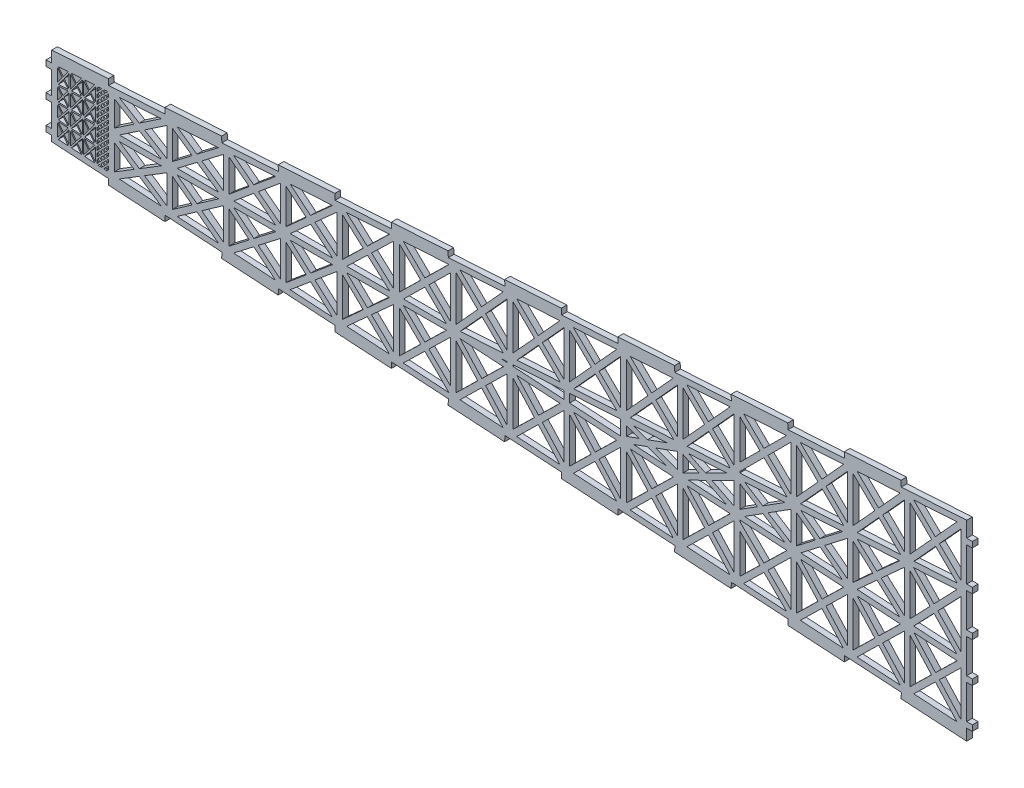
from build123d import *

# Parameters (mm, degrees)
BOSS_EXTRUDE1_DEPTH = 3


with BuildPart() as part:
    # Sketch1 → Boss-Extrude1 (new body)
    with BuildSketch(Plane.XY):
        Polygon((10.083362288, 109.807862194), (40.210617391, 107.96349508), (40.027302917, 104.969101018), (69.971243545, 103.135956273), (70.154558019, 106.130350336), (100.154558019, 104.293773681), (99.971243545, 101.299379618), (129.859124801, 99.469666785), (130.042439276, 102.464060847), (160.042439276, 100.627484192), (159.859124801, 97.633090129), (189.747006058, 95.803377296), (189.930320532, 98.797771359), (219.930320532, 96.961194703), (219.747006058, 93.96680064), (249.634887314, 92.137087807), (249.818201789, 95.13148187), (279.818201789, 93.294905215), (279.634887314, 90.300511152), (309.522768571, 88.470798319), (309.706083045, 91.465192381), (339.706083045, 89.628615726), (339.522768571, 86.634221663), (369.410649827, 84.80450883), (369.593964301, 87.798902893), (399.593964301, 85.962326237), (399.410649827, 82.967932175), (429.298531083, 81.138219341), (429.481845558, 84.132613404), (459.481845558, 82.296036749), (459.298531083, 79.301642686), (494, 77.177245762), (494, 83.177245762), (497, 83.177245762), (497, 86.177245762), (494, 86.177245762), (494, 104.177245762), (497, 104.177245762), (497, 107.177245762), (494, 107.177245762), (494, 125.177245762), (497, 125.177245762), (497, 128.177245762), (494, 128.177245762), (494, 146.177245762), (497, 146.177245762), (497, 149.177245762), (494, 149.177245762), (494, 167.177245762), (497, 167.177245762), (497, 170.177245762), (494, 170.177245762), (494, 178.42162933), (459.425786186, 176.305022864), (459.242471712, 179.299416927), (429.298531083, 177.466272182), (429.481845558, 174.47187812), (399.53790493, 172.638733375), (399.354590455, 175.633127438), (369.410649827, 173.799982694), (369.593964301, 170.805588631), (339.650023673, 168.972443887), (339.466709199, 171.966837949), (309.522768571, 170.133693205), (309.706083045, 167.139299142), (279.762142417, 165.306154398), (279.578827942, 168.300548461), (249.634887314, 166.467403716), (249.818201789, 163.473009654), (219.87426116, 161.639864909), (219.690946686, 164.634258972), (189.747006058, 162.801114228), (189.930320532, 159.806720165), (159.986379904, 157.973575421), (159.803065429, 160.967969483), (129.859124801, 159.134824739), (130.042439276, 156.140430676), (100.098498648, 154.307285932), (99.915184173, 157.301679995), (69.971243545, 155.46853525), (70.154558019, 152.474141188), (40.210617391, 150.640996443), (40.027302917, 153.635390506), (10.083362288, 151.802245762), (10.083362288, 145.807862194), (7.083362288, 145.807862194), (7.083362288, 142.807862194), (10.083362288, 142.807862194), (10.083362288, 130.807862194), (7.083362288, 130.807862194), (7.083362288, 127.807862194), (10.083362288, 127.807862194), (10.083362288, 115.807862194), (7.083362288, 115.807862194), (7.083362288, 112.807862194), (10.083362288, 112.807862194), align=None)
        Polygon((36.570630417, 111.302245762), (36.466696115, 111.19831146), (34.639232206, 111.310187378), (35.600960503, 112.271915676), align=None, mode=Mode.SUBTRACT)
        Polygon((16.179136888, 115.914254577), (18.817768783, 112.278765058), (13.540504992, 112.60183504), align=None, mode=Mode.SUBTRACT)
        Polygon((23.148450663, 115.487598611), (25.787082559, 111.852109091), (20.509818768, 112.175179074), align=None, mode=Mode.SUBTRACT)
        Polygon((35.070630417, 112.802245762), (34.100960503, 111.832575848), (33.991303615, 111.942232736), (33.991303615, 113.662258788), (34.100960503, 113.771915676), align=None, mode=Mode.SUBTRACT)
        Polygon((38.070630417, 112.802245762), (37.100960503, 111.832575848), (36.131290589, 112.802245762), (37.100960503, 113.771915676), align=None, mode=Mode.SUBTRACT)
        Polygon((30.117764439, 115.060942645), (32.756396334, 111.425453125), (27.479132544, 111.748523108), align=None, mode=Mode.SUBTRACT)
        Polygon((36.570630417, 114.302245762), (35.600960503, 113.332575848), (34.631290589, 114.302245762), (35.600960503, 115.271915676), align=None, mode=Mode.SUBTRACT)
        Polygon((39.570630417, 111.302245762), (39.293633225, 111.02524857), (37.817947446, 111.115588905), (37.631290589, 111.302245762), (38.600960503, 112.271915676), align=None, mode=Mode.SUBTRACT)
        Polygon((40.210617391, 113.662258788), (40.210617391, 111.942232736), (40.100960503, 111.832575848), (39.131290589, 112.802245762), (40.100960503, 113.771915676), align=None, mode=Mode.SUBTRACT)
        Polygon((39.570630417, 114.302245762), (38.600960503, 113.332575848), (37.631290589, 114.302245762), (38.600960503, 115.271915676), align=None, mode=Mode.SUBTRACT)
        Polygon((68.046554732, 109.265017089), (45.821916543, 110.625592145), (56.405206359, 117.106255753), align=None, mode=Mode.SUBTRACT)
        Polygon((86.897387515, 116.098494924), (98.307095104, 107.412490355), (76.405202547, 108.753307174), align=None, mode=Mode.SUBTRACT)
        Polygon((128.462910596, 105.566374796), (106.280709773, 106.92435187), (116.94674828, 115.116766423), align=None, mode=Mode.SUBTRACT)
        Polygon((13.083362288, 113.231683225), (13.083362288, 120.179592281), (15.721994184, 116.544102762), align=None, mode=Mode.SUBTRACT)
        Polygon((19.302676064, 112.887495799), (16.664044169, 116.522985319), (19.302676064, 119.835404856), align=None, mode=Mode.SUBTRACT)
        Polygon((20.052676064, 119.752936315), (22.69130796, 116.117446795), (20.052676064, 112.805027259), align=None, mode=Mode.SUBTRACT)
        Polygon((26.27198984, 112.460839833), (23.633357944, 116.096329353), (26.27198984, 119.40874889), align=None, mode=Mode.SUBTRACT)
        Polygon((27.02198984, 119.326280349), (29.660621735, 115.690790829), (27.02198984, 112.378371292), align=None, mode=Mode.SUBTRACT)
        Polygon((33.241303615, 112.034183867), (30.60267172, 115.669673387), (33.241303615, 118.982092923), align=None, mode=Mode.SUBTRACT)
        Polygon((35.070630417, 115.802245762), (34.100960503, 114.832575848), (33.991303615, 114.942232736), (33.991303615, 116.662258788), (34.100960503, 116.771915676), align=None, mode=Mode.SUBTRACT)
        Polygon((38.070630417, 115.802245762), (37.100960503, 114.832575848), (36.131290589, 115.802245762), (37.100960503, 116.771915676), align=None, mode=Mode.SUBTRACT)
        Polygon((23.17621524, 116.726177537), (20.537583345, 120.361667057), (25.814847136, 120.038597074), align=None, mode=Mode.SUBTRACT)
        Polygon((36.570630417, 117.302245762), (35.600960503, 116.332575848), (34.631290589, 117.302245762), (35.600960503, 118.271915676), align=None, mode=Mode.SUBTRACT)
        Polygon((30.145529016, 116.299521571), (27.506897121, 119.935011091), (32.784160912, 119.611941108), align=None, mode=Mode.SUBTRACT)
        Polygon((16.206901465, 117.152833503), (13.568269569, 120.788323023), (18.84553336, 120.46525304), align=None, mode=Mode.SUBTRACT)
        Polygon((35.070630417, 118.802245762), (34.100960503, 117.832575848), (33.991303615, 117.942232736), (33.991303615, 119.662258788), (34.100960503, 119.771915676), align=None, mode=Mode.SUBTRACT)
        Polygon((38.070630417, 118.802245762), (37.100960503, 117.832575848), (36.131290589, 118.802245762), (37.100960503, 119.771915676), align=None, mode=Mode.SUBTRACT)
        Polygon((36.570630417, 120.302245762), (35.600960503, 119.332575848), (34.631290589, 120.302245762), (35.600960503, 121.271915676), align=None, mode=Mode.SUBTRACT)
        Polygon((35.070630417, 121.802245762), (34.100960503, 120.832575848), (33.991303615, 120.942232736), (33.991303615, 122.662258788), (34.100960503, 122.771915676), align=None, mode=Mode.SUBTRACT)
        Polygon((38.070630417, 121.802245762), (37.100960503, 120.832575848), (36.131290589, 121.802245762), (37.100960503, 122.771915676), align=None, mode=Mode.SUBTRACT)
        Polygon((40.210617391, 116.662258788), (40.210617391, 114.942232736), (40.100960503, 114.832575848), (39.131290589, 115.802245762), (40.100960503, 116.771915676), align=None, mode=Mode.SUBTRACT)
        Polygon((39.570630417, 117.302245762), (38.600960503, 116.332575848), (37.631290589, 117.302245762), (38.600960503, 118.271915676), align=None, mode=Mode.SUBTRACT)
        Polygon((59.218045601, 118.828694166), (71, 126.043358456), (71, 110.892747796), align=None, mode=Mode.SUBTRACT)
        Polygon((40.210617391, 119.662258788), (40.210617391, 117.942232736), (40.100960503, 117.832575848), (39.131290589, 118.802245762), (40.100960503, 119.771915676), align=None, mode=Mode.SUBTRACT)
        Polygon((43.210617391, 112.544341153), (43.210617391, 125.993707434), (53.669589889, 118.948879215), align=None, mode=Mode.SUBTRACT)
        Polygon((39.570630417, 120.302245762), (38.600960503, 119.332575848), (37.631290589, 120.302245762), (38.600960503, 121.271915676), align=None, mode=Mode.SUBTRACT)
        Polygon((40.210617391, 122.662258788), (40.210617391, 120.942232736), (40.100960503, 120.832575848), (39.131290589, 121.802245762), (40.100960503, 122.771915676), align=None, mode=Mode.SUBTRACT)
        Polygon((16.107292866, 124.56600637), (18.796684139, 121.21964766), (13.550220923, 121.540832055), align=None, mode=Mode.SUBTRACT)
        Polygon((20.052676064, 128.308363796), (22.612515307, 124.947594711), (20.052676064, 121.743536993), align=None, mode=Mode.SUBTRACT)
        Polygon((23.081042729, 124.332473087), (25.777542335, 120.792284953), (20.510279859, 121.114742663), align=None, mode=Mode.SUBTRACT)
        Polygon((30.054355583, 124.098541892), (32.756903164, 120.365013914), (27.471568914, 120.688577964), align=None, mode=Mode.SUBTRACT)
        Polygon((36.570630417, 123.302245762), (35.600960503, 122.332575848), (34.631290589, 123.302245762), (35.600960503, 124.271915676), align=None, mode=Mode.SUBTRACT)
        Polygon((26.27198984, 121.380897227), (23.563687097, 124.936581497), (26.27198984, 128.32646558), align=None, mode=Mode.SUBTRACT)
        Polygon((27.02198984, 128.287708596), (29.594589452, 124.73370174), (27.02198984, 121.337187431), align=None, mode=Mode.SUBTRACT)
        Polygon((33.241303615, 120.974896461), (30.527779957, 124.723587722), (33.241303615, 128.306159176), align=None, mode=Mode.SUBTRACT)
        Polygon((35.070630417, 124.802245762), (34.100960503, 123.832575848), (33.991303615, 123.942232736), (33.991303615, 125.662258788), (34.100960503, 125.771915676), align=None, mode=Mode.SUBTRACT)
        Polygon((38.070630417, 124.802245762), (37.100960503, 123.832575848), (36.131290589, 124.802245762), (37.100960503, 125.771915676), align=None, mode=Mode.SUBTRACT)
        Polygon((13.083362288, 122.150316148), (13.083362288, 128.328626009), (15.628659743, 125.161560514), align=None, mode=Mode.SUBTRACT)
        Polygon((19.302676064, 121.78729098), (16.600523334, 125.149528529), (19.302676064, 128.346342391), align=None, mode=Mode.SUBTRACT)
        Polygon((16.121890211, 125.745082674), (13.56445917, 128.927245762), (18.811659165, 128.927245762), align=None, mode=Mode.SUBTRACT)
        Polygon((36.570630417, 126.302245762), (35.600960503, 125.332575848), (34.631290589, 126.302245762), (35.600960503, 127.271915676), align=None, mode=Mode.SUBTRACT)
        Polygon((23.095159676, 125.551703121), (20.524067672, 128.927245762), (25.792004514, 128.927245762), align=None, mode=Mode.SUBTRACT)
        Polygon((30.068013826, 125.35874757), (27.484924531, 128.927245762), (32.770878066, 128.927245762), align=None, mode=Mode.SUBTRACT)
        Polygon((33.991303615, 128.662258788), (34.100960503, 128.771915676), (35.070630417, 127.802245762), (34.100960503, 126.832575848), (33.991303615, 126.942232736), align=None, mode=Mode.SUBTRACT)
        Polygon((38.070630417, 127.802245762), (37.100960503, 126.832575848), (36.131290589, 127.802245762), (37.100960503, 128.771915676), align=None, mode=Mode.SUBTRACT)
        Polygon((39.570630417, 123.302245762), (38.600960503, 122.332575848), (37.631290589, 123.302245762), (38.600960503, 124.271915676), align=None, mode=Mode.SUBTRACT)
        Polygon((40.210617391, 125.662258788), (40.210617391, 123.942232736), (40.100960503, 123.832575848), (39.131290589, 124.802245762), (40.100960503, 125.771915676), align=None, mode=Mode.SUBTRACT)
        Polygon((45.895630005, 127.802245762), (68.127637657, 127.802245762), (56.482429131, 120.671317628), align=None, mode=Mode.SUBTRACT)
        Polygon((39.570630417, 126.302245762), (38.600960503, 125.332575848), (37.631290589, 126.302245762), (38.600960503, 127.271915676), align=None, mode=Mode.SUBTRACT)
        Polygon((40.210617391, 128.662258788), (40.210617391, 126.942232736), (40.100960503, 126.832575848), (39.131290589, 127.802245762), (40.100960503, 128.771915676), align=None, mode=Mode.SUBTRACT)
        Polygon((74, 125.917043384), (84.391425286, 118.006238764), (74, 110.731589114), align=None, mode=Mode.SUBTRACT)
        Polygon((101, 125.97120845), (101, 109.13283519), (89.477480189, 117.904721668), align=None, mode=Mode.SUBTRACT)
        Polygon((104, 125.853547738), (114.578631234, 117.080653748), (104, 108.955375331), align=None, mode=Mode.SUBTRACT)
        Polygon((119.386604767, 116.990781389), (131, 125.910845578), (131, 107.359754181), align=None, mode=Mode.SUBTRACT)
        Polygon((76.476352356, 127.802245762), (98.384466835, 127.802245762), (86.971517959, 119.812465509), align=None, mode=Mode.SUBTRACT)
        Polygon((106.349801309, 127.802245762), (128.53750899, 127.802245762), (117.018487721, 118.954668714), align=None, mode=Mode.SUBTRACT)
        Polygon((146.988532179, 114.13195406), (158.589584833, 103.722043243), (136.178951591, 105.094004771), align=None, mode=Mode.SUBTRACT)
        Polygon((188.694031125, 101.879072467), (166.094782397, 103.262580888), (177.024380413, 113.144323499), align=None, mode=Mode.SUBTRACT)
        Polygon((179.254836225, 115.160938402), (191, 125.780055883), (191, 103.822791134), align=None, mode=Mode.SUBTRACT)
        Polygon((220.106239517, 100.073348287), (220.358221681, 99.94061536), (196.02443741, 101.430310698), (207.429313816, 112.517540421), align=None, mode=Mode.SUBTRACT)
        Polygon((248.852730533, 98.196203701), (226.019913722, 99.594010979), (237.436322127, 110.747299257), align=None, mode=Mode.SUBTRACT)
        Polygon((194, 125.700307703), (205.287846907, 114.619692497), (194, 103.646232787), align=None, mode=Mode.SUBTRACT)
        Polygon((221, 125.710258156), (221, 103.399872322), (209.580966525, 114.609265664), align=None, mode=Mode.SUBTRACT)
        Polygon((239.583591595, 112.845079446), (251, 123.998367725), (251, 100.29398389), align=None, mode=Mode.SUBTRACT)
        Polygon((224, 125.519069586), (235.416408405, 112.96797403), (224, 101.814685751), align=None, mode=Mode.SUBTRACT)
        Polygon((134, 125.786884493), (144.732626969, 116.156233473), (134, 107.182625523), align=None, mode=Mode.SUBTRACT)
        Polygon((161, 125.84701873), (161, 105.58984077), (149.313819172, 116.076139199), align=None, mode=Mode.SUBTRACT)
        Polygon((164, 125.717357474), (174.86100063, 115.232733591), (164, 105.413011716), align=None, mode=Mode.SUBTRACT)
        Polygon((147.057913962, 118.100418611), (136.245966618, 127.802245762), (158.661506666, 127.802245762), align=None, mode=Mode.SUBTRACT)
        Polygon((166.159731552, 127.802245762), (188.763378044, 127.802245762), (177.091456443, 117.249348494), align=None, mode=Mode.SUBTRACT)
        Polygon((226.147269467, 127.616849775), (248.980086278, 126.219042497), (237.563677873, 115.065754219), align=None, mode=Mode.SUBTRACT)
        Polygon((196.141248891, 127.802245762), (218.848077411, 127.802245762), (207.439499616, 116.711417739), align=None, mode=Mode.SUBTRACT)
        Polygon((267.436322127, 108.910722602), (278.852730533, 96.359627046), (256.019913722, 97.757434324), align=None, mode=Mode.SUBTRACT)
        Polygon((308.852730533, 94.523050391), (286.019913722, 95.920857668), (297.436322127, 107.074145946), align=None, mode=Mode.SUBTRACT)
        Polygon((327.436322127, 105.237569291), (338.852730533, 92.686473735), (316.019913722, 94.084281013), align=None, mode=Mode.SUBTRACT)
        Polygon((368.852730533, 90.84989708), (346.019913722, 92.247704357), (357.436322127, 103.400992636), align=None, mode=Mode.SUBTRACT)
        Polygon((488.852730533, 83.503590458), (466.019913722, 84.901397736), (477.436322127, 96.054686014), align=None, mode=Mode.SUBTRACT)
        Polygon((386.779530312, 100.922761601), (398.734659857, 89.020548619), (376.019913722, 90.411127702), align=None, mode=Mode.SUBTRACT)
        Polygon((428.852730533, 87.176743769), (406.019913722, 88.574551047), (417.436322127, 99.727839325), align=None, mode=Mode.SUBTRACT)
        Polygon((404, 114.499609653), (415.416408405, 101.948514097), (404, 90.795225819), align=None, mode=Mode.SUBTRACT)
        Polygon((419.583591595, 101.825619514), (431, 112.978907792), (431, 89.274523958), align=None, mode=Mode.SUBTRACT)
        Polygon((447.436322127, 97.891262669), (458.852730533, 85.340167113), (436.019913722, 86.737974391), align=None, mode=Mode.SUBTRACT)
        Polygon((461, 111.142331136), (461, 87.437947302), (449.583591595, 99.989042858), align=None, mode=Mode.SUBTRACT)
        Polygon((434, 112.663032998), (445.416408405, 100.111937442), (434, 88.958649163), align=None, mode=Mode.SUBTRACT)
        Polygon((464, 110.826456342), (475.416408405, 98.275360786), (464, 87.122072508), align=None, mode=Mode.SUBTRACT)
        Polygon((479.583591595, 98.152466203), (491, 109.305754481), (491, 85.601370647), align=None, mode=Mode.SUBTRACT)
        Polygon((299.583591595, 109.171926135), (311, 120.325214414), (311, 96.62083058), align=None, mode=Mode.SUBTRACT)
        Polygon((254, 123.68249293), (265.416408405, 111.131397374), (254, 99.978109096), align=None, mode=Mode.SUBTRACT)
        Polygon((281, 122.161791069), (281, 98.457407235), (269.583591595, 111.008502791), align=None, mode=Mode.SUBTRACT)
        Polygon((284, 121.845916275), (295.416408405, 109.294820719), (284, 98.141532441), align=None, mode=Mode.SUBTRACT)
        Polygon((314, 120.009339619), (325.416408405, 107.458244063), (314, 96.304955785), align=None, mode=Mode.SUBTRACT)
        Polygon((341, 118.488637758), (341, 94.784253924), (329.583591595, 107.33534948), align=None, mode=Mode.SUBTRACT)
        Polygon((370.990056628, 116.642346901), (371, 116.632447541), (371, 92.947677269), (359.583591595, 105.498772825), align=None, mode=Mode.SUBTRACT)
        Polygon((344, 118.172762964), (355.416408405, 105.621667408), (344, 94.46837913), align=None, mode=Mode.SUBTRACT)
        Polygon((346.147269467, 120.270543153), (368.980086278, 118.872735875), (357.563677873, 107.719447597), align=None, mode=Mode.SUBTRACT)
        Polygon((267.563677873, 113.229177563), (256.147269467, 125.780273119), (278.980086278, 124.382465841), align=None, mode=Mode.SUBTRACT)
        Polygon((286.147269467, 123.943696464), (308.980086278, 122.545889186), (297.563677873, 111.392600908), align=None, mode=Mode.SUBTRACT)
        Polygon((327.563677873, 109.556024252), (316.147269467, 122.107119808), (338.980086278, 120.709312531), align=None, mode=Mode.SUBTRACT)
        Polygon((317.770760818, 125.013347363), (325.215801154, 127.707081444), (335.693340428, 123.916140986), align=None, mode=Mode.SUBTRACT)
        Polygon((355.83997154, 127.62662879), (367.162469672, 121.989625382), (346.997108481, 123.224133102), align=None, mode=Mode.SUBTRACT)
        Polygon((374, 113.645726334), (384.653305342, 103.039575337), (374, 92.631802474), align=None, mode=Mode.SUBTRACT)
        Polygon((401, 114.815484447), (401, 90.998497046), (388.925642027, 103.01941072), align=None, mode=Mode.SUBTRACT)
        Polygon((398.980086278, 117.03615922), (386.799417056, 105.136224456), (374, 117.87898791), (374, 118.565420663), align=None, mode=Mode.SUBTRACT)
        Polygon((406.147269467, 116.597389842), (428.980086278, 115.199582564), (417.563677873, 104.046294286), align=None, mode=Mode.SUBTRACT)
        Polygon((447.563677873, 102.209717631), (436.147269467, 114.760813187), (458.980086278, 113.363005909), align=None, mode=Mode.SUBTRACT)
        Polygon((466.147269467, 112.924236531), (488.980086278, 111.526429253), (477.563677873, 100.373140975), align=None, mode=Mode.SUBTRACT)
        Polygon((376.554929597, 121.414626294), (386.196233253, 127.526261652), (397.898830891, 120.107969265), align=None, mode=Mode.SUBTRACT)
        Polygon((416.426597999, 127.40914482), (428.328863278, 118.245066362), (406.277652276, 119.59502434), align=None, mode=Mode.SUBTRACT)
        Polygon((436.092689697, 117.76977095), (446.587779737, 127.278183736), (458.604001223, 116.391645975), align=None, mode=Mode.SUBTRACT)
        Polygon((476.706875139, 127.135887692), (488.791256742, 114.543605683), (465.963617128, 115.941096017), align=None, mode=Mode.SUBTRACT)
        Polygon((16.121890211, 132.85940885), (18.811659165, 129.677245762), (13.56445917, 129.677245762), align=None, mode=Mode.SUBTRACT)
        Polygon((34.631290589, 129.302245762), (35.600960503, 130.271915676), (36.570630417, 129.302245762), (35.600960503, 128.332575848), align=None, mode=Mode.SUBTRACT)
        Polygon((23.095159676, 133.052788403), (25.792004514, 129.677245762), (20.524067672, 129.677245762), align=None, mode=Mode.SUBTRACT)
        Polygon((33.991303615, 131.662258788), (34.100960503, 131.771915676), (35.070630417, 130.802245762), (34.100960503, 129.832575848), (33.991303615, 129.942232736), align=None, mode=Mode.SUBTRACT)
        Polygon((37.100960503, 129.832575848), (36.131290589, 130.802245762), (37.100960503, 131.771915676), (38.070630417, 130.802245762), align=None, mode=Mode.SUBTRACT)
        Polygon((13.083362288, 130.275865514), (13.083362288, 136.454175375), (15.628659743, 133.44293101), align=None, mode=Mode.SUBTRACT)
        Polygon((19.302676064, 130.258149133), (16.600523334, 133.454962994), (19.302676064, 136.817200544), align=None, mode=Mode.SUBTRACT)
        Polygon((20.052676064, 136.86095453), (22.612515307, 133.656896812), (20.052676064, 130.296127728), align=None, mode=Mode.SUBTRACT)
        Polygon((30.068013826, 133.245743953), (32.770878066, 129.677245762), (27.484924531, 129.677245762), align=None, mode=Mode.SUBTRACT)
        Polygon((35.600960503, 131.332575848), (34.631290589, 132.302245762), (35.600960503, 133.271915676), (36.570630417, 132.302245762), align=None, mode=Mode.SUBTRACT)
        Polygon((26.27198984, 130.278025944), (23.563687097, 133.667910027), (26.27198984, 137.223594296), align=None, mode=Mode.SUBTRACT)
        Polygon((27.02198984, 137.267304093), (29.594589452, 133.870789783), (27.02198984, 130.316782928), align=None, mode=Mode.SUBTRACT)
        Polygon((33.991303615, 134.662258788), (34.100960503, 134.771915676), (35.070630417, 133.802245762), (34.100960503, 132.832575848), (33.991303615, 132.942232736), align=None, mode=Mode.SUBTRACT)
        Polygon((37.100960503, 132.832575848), (36.131290589, 133.802245762), (37.100960503, 134.771915676), (38.070630417, 133.802245762), align=None, mode=Mode.SUBTRACT)
        Polygon((33.241303615, 130.298332348), (30.527779957, 133.880903802), (33.241303615, 137.629595062), align=None, mode=Mode.SUBTRACT)
        Polygon((39.570630417, 129.302245762), (38.600960503, 128.332575848), (37.631290589, 129.302245762), (38.600960503, 130.271915676), align=None, mode=Mode.SUBTRACT)
        Polygon((40.210617391, 131.662258788), (40.210617391, 129.942232736), (40.100960503, 129.832575848), (39.131290589, 130.802245762), (40.100960503, 131.771915676), align=None, mode=Mode.SUBTRACT)
        Polygon((38.600960503, 131.332575848), (37.631290589, 132.302245762), (38.600960503, 133.271915676), (39.570630417, 132.302245762), align=None, mode=Mode.SUBTRACT)
        Polygon((39.131290589, 133.802245762), (40.100960503, 134.771915676), (40.210617391, 134.662258788), (40.210617391, 132.942232736), (40.100960503, 132.832575848), align=None, mode=Mode.SUBTRACT)
        Polygon((45.895630005, 130.802245762), (56.482429131, 137.933173896), (68.127637657, 130.802245762), align=None, mode=Mode.SUBTRACT)
        Polygon((16.107292866, 134.038485154), (13.550220923, 137.063659469), (18.796684139, 137.384843864), align=None, mode=Mode.SUBTRACT)
        Polygon((23.081042729, 134.272018436), (20.510279859, 137.489748861), (25.777542335, 137.812206571), align=None, mode=Mode.SUBTRACT)
        Polygon((35.600960503, 134.332575848), (34.631290589, 135.302245762), (35.600960503, 136.271915676), (36.570630417, 135.302245762), align=None, mode=Mode.SUBTRACT)
        Polygon((30.054355583, 134.505949632), (27.471568914, 137.91591356), (32.756903164, 138.23947761), align=None, mode=Mode.SUBTRACT)
        Polygon((33.991303615, 137.662258788), (34.100960503, 137.771915676), (35.070630417, 136.802245762), (34.100960503, 135.832575848), (33.991303615, 135.942232736), align=None, mode=Mode.SUBTRACT)
        Polygon((37.100960503, 135.832575848), (36.131290589, 136.802245762), (37.100960503, 137.771915676), (38.070630417, 136.802245762), align=None, mode=Mode.SUBTRACT)
        Polygon((16.206901465, 141.45165802), (18.84553336, 138.139238483), (13.568269569, 137.816168501), align=None, mode=Mode.SUBTRACT)
        Polygon((35.600960503, 137.332575848), (34.631290589, 138.302245762), (35.600960503, 139.271915676), (36.570630417, 138.302245762), align=None, mode=Mode.SUBTRACT)
        Polygon((23.17621524, 141.878313986), (25.814847136, 138.56589445), (20.537583345, 138.242824467), align=None, mode=Mode.SUBTRACT)
        Polygon((33.991303615, 140.662258788), (34.100960503, 140.771915676), (35.070630417, 139.802245762), (34.100960503, 138.832575848), (33.991303615, 138.942232736), align=None, mode=Mode.SUBTRACT)
        Polygon((37.100960503, 138.832575848), (36.131290589, 139.802245762), (37.100960503, 140.771915676), (38.070630417, 139.802245762), align=None, mode=Mode.SUBTRACT)
        Polygon((30.145529016, 142.304969953), (32.784160912, 138.992550416), (27.506897121, 138.669480433), align=None, mode=Mode.SUBTRACT)
        Polygon((38.600960503, 134.332575848), (37.631290589, 135.302245762), (38.600960503, 136.271915676), (39.570630417, 135.302245762), align=None, mode=Mode.SUBTRACT)
        Polygon((39.131290589, 136.802245762), (40.100960503, 137.771915676), (40.210617391, 137.662258788), (40.210617391, 135.942232736), (40.100960503, 135.832575848), align=None, mode=Mode.SUBTRACT)
        Polygon((38.600960503, 137.332575848), (37.631290589, 138.302245762), (38.600960503, 139.271915676), (39.570630417, 138.302245762), align=None, mode=Mode.SUBTRACT)
        Polygon((53.669589889, 139.655612309), (43.210617391, 132.61078409), (43.210617391, 146.060150371), align=None, mode=Mode.SUBTRACT)
        Polygon((39.131290589, 139.802245762), (40.100960503, 140.771915676), (40.210617391, 140.662258788), (40.210617391, 138.942232736), (40.100960503, 138.832575848), align=None, mode=Mode.SUBTRACT)
        Polygon((59.218045601, 139.775797357), (71, 147.711743728), (71, 132.561133067), align=None, mode=Mode.SUBTRACT)
        Polygon((86.971517959, 138.792026015), (98.384466835, 130.802245762), (76.476352356, 130.802245762), align=None, mode=Mode.SUBTRACT)
        Polygon((74, 147.872902409), (84.391425286, 140.598252759), (74, 132.687448139), align=None, mode=Mode.SUBTRACT)
        Polygon((106.349801309, 130.802245762), (117.018487721, 139.64982281), (128.53750899, 130.802245762), align=None, mode=Mode.SUBTRACT)
        Polygon((13.083362288, 138.424899243), (13.083362288, 145.372808299), (15.721994184, 142.060388762), align=None, mode=Mode.SUBTRACT)
        Polygon((19.302676064, 138.769086668), (16.664044169, 142.081506205), (19.302676064, 145.716995724), align=None, mode=Mode.SUBTRACT)
        Polygon((20.052676064, 145.799464265), (22.69130796, 142.487044728), (20.052676064, 138.851555209), align=None, mode=Mode.SUBTRACT)
        Polygon((35.600960503, 140.332575848), (34.631290589, 141.302245762), (35.600960503, 142.271915676), (36.570630417, 141.302245762), align=None, mode=Mode.SUBTRACT)
        Polygon((26.27198984, 139.195742634), (23.633357944, 142.508162171), (26.27198984, 146.143651691), align=None, mode=Mode.SUBTRACT)
        Polygon((27.02198984, 146.226120231), (29.660621735, 142.913700694), (27.02198984, 139.278211175), align=None, mode=Mode.SUBTRACT)
        Polygon((33.241303615, 139.6223986), (30.60267172, 142.934818137), (33.241303615, 146.570307657), align=None, mode=Mode.SUBTRACT)
        Polygon((33.991303615, 143.662258788), (34.100960503, 143.771915676), (35.070630417, 142.802245762), (34.100960503, 141.832575848), (33.991303615, 141.942232736), align=None, mode=Mode.SUBTRACT)
        Polygon((37.100960503, 141.832575848), (36.131290589, 142.802245762), (37.100960503, 143.771915676), (38.070630417, 142.802245762), align=None, mode=Mode.SUBTRACT)
        Polygon((16.179136888, 142.690236947), (13.540504992, 146.002656483), (18.817768783, 146.325726466), align=None, mode=Mode.SUBTRACT)
        Polygon((23.148450663, 143.116892913), (20.509818768, 146.42931245), (25.787082559, 146.752382432), align=None, mode=Mode.SUBTRACT)
        Polygon((35.600960503, 143.332575848), (34.631290589, 144.302245762), (35.600960503, 145.271915676), (36.570630417, 144.302245762), align=None, mode=Mode.SUBTRACT)
        Polygon((30.117764439, 143.543548879), (27.479132544, 146.855968416), (32.756396334, 147.179038398), align=None, mode=Mode.SUBTRACT)
        Polygon((33.991303615, 146.662258788), (34.100960503, 146.771915676), (35.070630417, 145.802245762), (34.100960503, 144.832575848), (33.991303615, 144.942232736), align=None, mode=Mode.SUBTRACT)
        Polygon((37.100960503, 144.832575848), (36.131290589, 145.802245762), (37.100960503, 146.771915676), (38.070630417, 145.802245762), align=None, mode=Mode.SUBTRACT)
        Polygon((36.570630417, 147.302245762), (35.600960503, 146.332575848), (34.639232206, 147.294304145), (36.466696115, 147.406180064), align=None, mode=Mode.SUBTRACT)
        Polygon((38.600960503, 140.332575848), (37.631290589, 141.302245762), (38.600960503, 142.271915676), (39.570630417, 141.302245762), align=None, mode=Mode.SUBTRACT)
        Polygon((39.131290589, 142.802245762), (40.100960503, 143.771915676), (40.210617391, 143.662258788), (40.210617391, 141.942232736), (40.100960503, 141.832575848), align=None, mode=Mode.SUBTRACT)
        Polygon((38.600960503, 143.332575848), (37.631290589, 144.302245762), (38.600960503, 145.271915676), (39.570630417, 144.302245762), align=None, mode=Mode.SUBTRACT)
        Polygon((39.131290589, 145.802245762), (40.100960503, 146.771915676), (40.210617391, 146.662258788), (40.210617391, 144.942232736), (40.100960503, 144.832575848), align=None, mode=Mode.SUBTRACT)
        Polygon((37.631290589, 147.302245762), (37.817947446, 147.488902619), (39.293633225, 147.579242954), (39.570630417, 147.302245762), (38.600960503, 146.332575848), align=None, mode=Mode.SUBTRACT)
        Polygon((68.046554732, 149.339474434), (56.405206359, 141.498235771), (45.821916543, 147.978899379), align=None, mode=Mode.SUBTRACT)
        Polygon((101, 132.633283074), (89.477480189, 140.699769855), (101, 149.471656333), align=None, mode=Mode.SUBTRACT)
        Polygon((86.897387515, 142.5059966), (76.405202547, 149.851184349), (98.307095104, 151.192001169), align=None, mode=Mode.SUBTRACT)
        Polygon((114.578631234, 141.523837775), (104, 132.750943785), (104, 149.649116193), align=None, mode=Mode.SUBTRACT)
        Polygon((119.386604767, 141.613710135), (131, 151.244737343), (131, 132.693645945), align=None, mode=Mode.SUBTRACT)
        Polygon((128.462910596, 153.038116727), (116.94674828, 143.4877251), (106.280709773, 151.680139654), align=None, mode=Mode.SUBTRACT)
        Polygon((147.057913962, 140.504072913), (158.661506666, 130.802245762), (136.245966618, 130.802245762), align=None, mode=Mode.SUBTRACT)
        Polygon((166.159731552, 130.802245762), (177.091456443, 141.355143029), (188.763378044, 130.802245762), align=None, mode=Mode.SUBTRACT)
        Polygon((247.71272563, 129.302245762), (251, 129.503490141), (251, 129.101001383), align=None, mode=Mode.SUBTRACT)
        Polygon((207.439499616, 141.893073784), (218.848077411, 130.802245762), (196.141248891, 130.802245762), align=None, mode=Mode.SUBTRACT)
        Polygon((226.147269467, 130.987641749), (237.563677873, 143.538737305), (248.980086278, 132.385449027), align=None, mode=Mode.SUBTRACT)
        Polygon((134, 151.421866), (144.732626969, 142.448258051), (134, 132.81760703), align=None, mode=Mode.SUBTRACT)
        Polygon((161, 132.757472793), (149.313819172, 142.528352325), (161, 153.014650753), align=None, mode=Mode.SUBTRACT)
        Polygon((164, 153.191479808), (174.86100063, 143.371757932), (164, 132.887134049), align=None, mode=Mode.SUBTRACT)
        Polygon((179.254836225, 143.443553122), (191, 154.78170039), (191, 132.824435641), align=None, mode=Mode.SUBTRACT)
        Polygon((146.988532179, 144.472537463), (136.178951591, 153.510486753), (158.589584833, 154.882448281), align=None, mode=Mode.SUBTRACT)
        Polygon((188.694031125, 156.725419057), (177.024380413, 145.460168025), (166.094782397, 155.341910636), align=None, mode=Mode.SUBTRACT)
        Polygon((194, 154.958258737), (205.287846907, 143.984799027), (194, 132.904183821), align=None, mode=Mode.SUBTRACT)
        Polygon((221, 132.894233368), (209.580966525, 143.99522586), (221, 155.204619201), align=None, mode=Mode.SUBTRACT)
        Polygon((224, 156.789805772), (235.416408405, 145.636517494), (224, 133.085421938), align=None, mode=Mode.SUBTRACT)
        Polygon((239.583591595, 145.759412077), (251, 158.310507633), (251, 134.606123799), align=None, mode=Mode.SUBTRACT)
        Polygon((207.429313816, 146.086951103), (196.02443741, 157.174180826), (220.358221681, 158.663876163), (220.106239517, 158.531143237), align=None, mode=Mode.SUBTRACT)
        Polygon((248.852730533, 160.408287822), (237.436322127, 147.857192266), (226.019913722, 159.010480545), align=None, mode=Mode.SUBTRACT)
        Polygon((281, 127.264424727), (254, 128.917343717), (254, 129.687147806), (281, 131.340066796), align=None, mode=Mode.SUBTRACT)
        Polygon((311, 125.427848072), (284, 127.080767062), (284, 131.523724462), (311, 133.176643452), align=None, mode=Mode.SUBTRACT)
        Polygon((267.563677873, 145.375313961), (278.980086278, 134.222025682), (256.147269467, 132.824218405), align=None, mode=Mode.SUBTRACT)
        Polygon((286.147269467, 134.66079506), (297.563677873, 147.211890616), (308.980086278, 136.058602338), align=None, mode=Mode.SUBTRACT)
        Polygon((314, 131.765136799), (320.807027929, 129.302245762), (314, 126.839354725), align=None, mode=Mode.SUBTRACT)
        Polygon((341, 125.186435735), (329.62457438, 129.302245762), (341, 133.418055789), align=None, mode=Mode.SUBTRACT)
        Polygon((325.215801154, 130.89741008), (317.770760818, 133.59114416), (335.693340428, 134.688350538), align=None, mode=Mode.SUBTRACT)
        Polygon((344, 133.521260801), (352.474323402, 129.302245762), (344, 125.083230722), align=None, mode=Mode.SUBTRACT)
        Polygon((371, 135.174179791), (371, 123.430311733), (359.205619678, 129.302245762), align=None, mode=Mode.SUBTRACT)
        Polygon((367.162469672, 136.614866142), (355.83997154, 130.977862733), (346.997108481, 135.380358422), align=None, mode=Mode.SUBTRACT)
        Polygon((254, 158.626382428), (265.416408405, 147.473094149), (254, 134.921998594), align=None, mode=Mode.SUBTRACT)
        Polygon((281, 136.442700455), (269.583591595, 147.595988733), (281, 160.147084289), align=None, mode=Mode.SUBTRACT)
        Polygon((284, 160.462959083), (295.416408405, 149.309670805), (284, 136.758575249), align=None, mode=Mode.SUBTRACT)
        Polygon((299.583591595, 149.432565388), (311, 161.983660944), (311, 138.27927711), align=None, mode=Mode.SUBTRACT)
        Polygon((327.563677873, 149.048467271), (338.980086278, 137.895178993), (316.147269467, 136.497371715), align=None, mode=Mode.SUBTRACT)
        Polygon((346.147269467, 138.333948371), (357.563677873, 150.885043927), (368.980086278, 139.731755649), align=None, mode=Mode.SUBTRACT)
        Polygon((314, 162.299535739), (325.416408405, 151.14624746), (314, 138.595151904), align=None, mode=Mode.SUBTRACT)
        Polygon((341, 140.115853765), (329.583591595, 151.269142044), (341, 163.8202376), align=None, mode=Mode.SUBTRACT)
        Polygon((344, 164.136112394), (355.416408405, 152.982824116), (344, 140.43172856), align=None, mode=Mode.SUBTRACT)
        Polygon((374, 135.257470318), (383.394560526, 129.302245762), (374, 123.347021206), align=None, mode=Mode.SUBTRACT)
        Polygon((401, 121.694102216), (388.997905979, 129.302245762), (401, 136.910389308), align=None, mode=Mode.SUBTRACT)
        Polygon((404, 136.976930142), (413.967846722, 129.302245762), (404, 121.627561382), align=None, mode=Mode.SUBTRACT)
        Polygon((431, 138.629849131), (431, 119.974642392), (418.885349276, 129.302245762), align=None, mode=Mode.SUBTRACT)
        Polygon((386.196233253, 131.078229872), (376.554929597, 137.18986523), (397.898830891, 138.496522258), align=None, mode=Mode.SUBTRACT)
        Polygon((428.328863278, 140.359425162), (416.426597999, 131.195346704), (406.277652276, 139.009467184), align=None, mode=Mode.SUBTRACT)
        Polygon((434, 138.682545713), (444.353683081, 129.302245762), (434, 119.921945811), align=None, mode=Mode.SUBTRACT)
        Polygon((461, 118.269026821), (448.821876393, 129.302245762), (461, 140.335464703), align=None, mode=Mode.SUBTRACT)
        Polygon((464, 140.376826325), (474.627895525, 129.302245762), (464, 118.227665199), align=None, mode=Mode.SUBTRACT)
        Polygon((491, 142.029745315), (491, 116.574746209), (478.785854754, 129.302245762), align=None, mode=Mode.SUBTRACT)
        Polygon((446.587779737, 131.326307788), (436.092689697, 140.834720574), (458.604001223, 142.212845548), align=None, mode=Mode.SUBTRACT)
        Polygon((488.791256742, 144.060885841), (476.706875139, 131.468603831), (465.963617128, 142.663395507), align=None, mode=Mode.SUBTRACT)
        Polygon((374, 140.725503614), (386.799417056, 153.468267067), (398.980086278, 141.568332304), (374, 140.03907086), align=None, mode=Mode.SUBTRACT)
        Polygon((406.147269467, 142.007101682), (417.563677873, 154.558197238), (428.980086278, 143.40490896), align=None, mode=Mode.SUBTRACT)
        Polygon((447.563677873, 156.394773893), (458.980086278, 145.241485615), (436.147269467, 143.843678337), align=None, mode=Mode.SUBTRACT)
        Polygon((466.147269467, 145.680254993), (477.563677873, 158.231350549), (488.980086278, 147.07806227), align=None, mode=Mode.SUBTRACT)
        Polygon((267.436322127, 149.693768922), (256.019913722, 160.8470572), (278.852730533, 162.244864478), align=None, mode=Mode.SUBTRACT)
        Polygon((308.852730533, 164.081441133), (297.436322127, 151.530345577), (286.019913722, 162.683633855), align=None, mode=Mode.SUBTRACT)
        Polygon((327.436322127, 153.366922233), (316.019913722, 164.520210511), (338.852730533, 165.918017789), align=None, mode=Mode.SUBTRACT)
        Polygon((359.583591595, 153.105718699), (371, 165.656814255), (371, 141.972043983), (370.990056628, 141.962144623), align=None, mode=Mode.SUBTRACT)
        Polygon((368.852730533, 167.754594444), (357.436322127, 155.203498888), (346.019913722, 166.356787166), align=None, mode=Mode.SUBTRACT)
        Polygon((374, 165.972689049), (384.653305342, 155.564916186), (374, 144.95876519), align=None, mode=Mode.SUBTRACT)
        Polygon((401, 143.789007076), (388.925642027, 155.585080804), (401, 167.605994478), align=None, mode=Mode.SUBTRACT)
        Polygon((404, 167.809265705), (415.416408405, 156.655977427), (404, 144.104881871), align=None, mode=Mode.SUBTRACT)
        Polygon((419.583591595, 156.77887201), (431, 169.329967566), (431, 145.625583732), align=None, mode=Mode.SUBTRACT)
        Polygon((386.779530312, 157.681729923), (376.019913722, 168.193363822), (398.734659857, 169.583942905), align=None, mode=Mode.SUBTRACT)
        Polygon((428.852730533, 171.427747755), (417.436322127, 158.876652199), (406.019913722, 170.029940477), align=None, mode=Mode.SUBTRACT)
        Polygon((434, 169.64584236), (445.416408405, 158.492554082), (434, 145.941458526), align=None, mode=Mode.SUBTRACT)
        Polygon((461, 147.462160387), (449.583591595, 158.615448665), (461, 171.166544221), align=None, mode=Mode.SUBTRACT)
        Polygon((475.416408405, 160.329130738), (464, 147.778035182), (464, 171.482419016), align=None, mode=Mode.SUBTRACT)
        Polygon((479.583591595, 160.452025321), (491, 173.003120877), (491, 149.298737043), align=None, mode=Mode.SUBTRACT)
        Polygon((447.436322127, 160.713228854), (436.019913722, 171.866517133), (458.852730533, 173.26432441), align=None, mode=Mode.SUBTRACT)
        Polygon((488.852730533, 175.100901066), (477.436322127, 162.54980551), (466.019913722, 173.703093788), align=None, mode=Mode.SUBTRACT)
    extrude(amount=BOSS_EXTRUDE1_DEPTH)


solid = part.part
